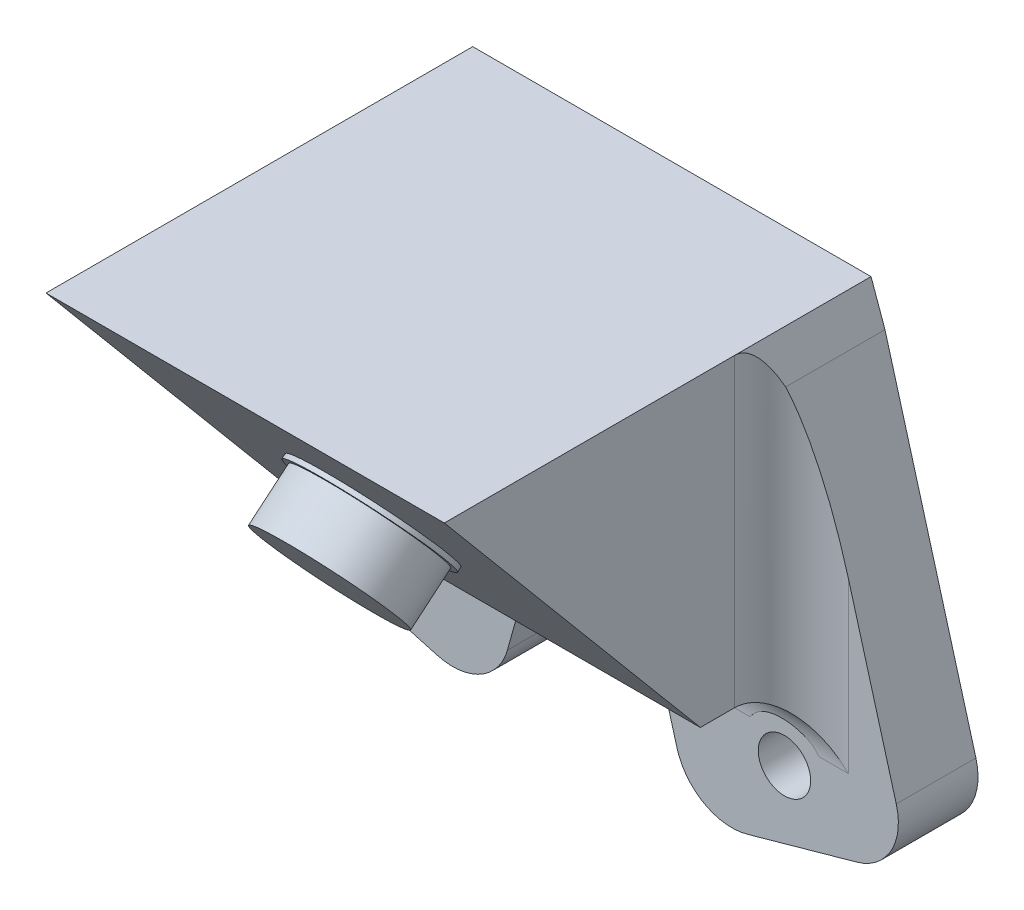
from build123d import *

# Parameters (mm, degrees)
AUFSATZ_LINEAR_AUSTRAGEN1_DEPTH    = 35
SKIZZE3_R                          = 6
AUFSATZ_LINEAR_AUSTRAGEN2_DEPTH    = 5
SKIZZE4_R                          = 6.5
AUFSATZ_LINEAR_AUSTRAGEN3_DEPTH    = 0.4
K_RPER_VERSCHIEBEN_KOPIEREN1_ANGLE = 90
SKIZZE9_R                          = 2.3
AUFSATZ_LINEAR_AUSTRAGEN4_DEPTH    = 7
VERRUNDUNG1_R                      = 5
SKIZZE11_R                         = 3.75
SCHNITT_LINEAR_AUSTRAGEN2_DEPTH    = 10
SKIZZE12_R                         = 1.425000005
SCHNITT_LINEAR_AUSTRAGEN3_DEPTH    = 9


with BuildPart() as part:
    # Skizze1 → Aufsatz-Linear austragen1 (new body)
    with BuildSketch(Plane(origin=(0, 0, 0), x_dir=(0, 0, -1), z_dir=(1, 0, 0))):
        Polygon((0, 0), (26.811555509, 0), (26.811555509, 37.497566339), (0, 15), align=None)
    extrude(amount=AUFSATZ_LINEAR_AUSTRAGEN1_DEPTH)

    # Skizze3 → Aufsatz-Linear austragen2 (add)
    with BuildSketch(Plane(origin=(0, 8.802361333, 7.386058148), x_dir=(1, 0, 0), z_dir=(0, 0.7660444431189768, 0.642787609686541))):
        with Locations(Location((17.5, 27.141814145, 0), (0, 0, 90))):
            Circle(SKIZZE3_R)
    extrude(amount=AUFSATZ_LINEAR_AUSTRAGEN2_DEPTH)

    # Skizze4 → Aufsatz-Linear austragen3 (add)
    with BuildSketch(Plane(origin=(0, 8.802361333, 7.386058148), x_dir=(1, 0, 0), z_dir=(0, 0.7660444431189767, 0.6427876096865409))):
        with Locations(Location((17.5, 27.141814145, 0), (0, 0, 90))):
            Circle(SKIZZE4_R)
    extrude(amount=AUFSATZ_LINEAR_AUSTRAGEN3_DEPTH)


with BuildPart() as part_1:
    # Körper-Verschieben/Kopieren1: moved
    add(part.part.rotate(Axis((0, 13.64378317, -13.405777755), (1, 0, 0)), K_RPER_VERSCHIEBEN_KOPIEREN1_ANGLE))

    # Skizze9 → Aufsatz-Linear austragen4 (add)
    # profile 1 of 2: a face of its own
    with BuildSketch(Plane(origin=(0, 0, -27.049560924), x_dir=(-1, 0, 0), z_dir=(0, 0, -1))):
        Polygon((-13.006801175, 0.238005415), (-8.700779715, -15.171672686), (10.561317912, -9.789145862), (1.223844944, 23.626259531), (0, 27.049560924), (0, 0.238005415), align=None)
        with Locations(Location((-0.609417277, -6.970434083, 0), (0, 0, 90))):
            Circle(SKIZZE9_R, mode=Mode.SUBTRACT)
    # profile 2 of 2: a face of its own
    with BuildSketch(Plane(origin=(0, 0, -27.049560924), x_dir=(-1, 0, 0), z_dir=(0, 0, -1))):
        Polygon((-45.561317912, -9.789145862), (-36.223844944, 23.626259531), (-35, 27.049560924), (-35, 0.238005415), (-21.993198825, 0.238005415), (-26.299220285, -15.171672686), align=None)
        with Locations(Location((-34.390582723, -6.970434083, 0), (0, 0, 270))):
            Circle(SKIZZE9_R, mode=Mode.SUBTRACT)
    extrude(amount=-AUFSATZ_LINEAR_AUSTRAGEN4_DEPTH)

    # Verrundung1
    # the kernel refuses this fillet: 5 mm, written as the material it adds along each edge
    with BuildSketch(Plane(origin=(35, 27.049560924, -20.049560924), x_dir=(1, 0, 0), z_dir=(0, -1, 0))) as verrundung1_piece_1_section:
        with BuildLine():
            CenterArc((VERRUNDUNG1_R, VERRUNDUNG1_R), VERRUNDUNG1_R, 180, 90)
            Line((0, VERRUNDUNG1_R), (-VERRUNDUNG1_R * 0.02, VERRUNDUNG1_R))
            Line((-VERRUNDUNG1_R * 0.02, VERRUNDUNG1_R), (-VERRUNDUNG1_R * 0.02, -VERRUNDUNG1_R * 0.02))
            Line((-VERRUNDUNG1_R * 0.02, -VERRUNDUNG1_R * 0.02), (VERRUNDUNG1_R, -VERRUNDUNG1_R * 0.02))
            Line((VERRUNDUNG1_R, -VERRUNDUNG1_R * 0.02), (VERRUNDUNG1_R, 0))
        make_face()
    verrundung1_piece_1 = extrude(amount=26.811555509, mode=Mode.PRIVATE)
    verrundung1_piece_1 = split(verrundung1_piece_1, bisect_by=Plane(origin=(39.17481741, 13.065806869, -18.82374956), z_dir=(-0.9631048813334838, -0.2691263412444353, -1.6244750072279728e-13)), keep=Keep.TOP, mode=Mode.PRIVATE)
    verrundung1_piece_1 = split(verrundung1_piece_1, bisect_by=Plane(origin=(39.826476164, 13.549090416, -18.82374956), z_dir=(-0.9416340631335743, -0.3366382199729496, -2.0319838344143382e-13)), keep=Keep.TOP, mode=Mode.PRIVATE)
    add(verrundung1_piece_1)
    with BuildSketch(Plane(origin=(35, 0.238005415, -20.049560924), x_dir=(0, 0, 1), z_dir=(-1, 0, 0))) as verrundung1_piece_2_section:
        with BuildLine():
            CenterArc((VERRUNDUNG1_R, -VERRUNDUNG1_R), VERRUNDUNG1_R, 90, 90)
            Line((0, -VERRUNDUNG1_R), (-VERRUNDUNG1_R * 0.02, -VERRUNDUNG1_R))
            Line((-VERRUNDUNG1_R * 0.02, -VERRUNDUNG1_R), (-VERRUNDUNG1_R * 0.02, VERRUNDUNG1_R * 0.02))
            Line((-VERRUNDUNG1_R * 0.02, VERRUNDUNG1_R * 0.02), (VERRUNDUNG1_R, VERRUNDUNG1_R * 0.02))
            Line((VERRUNDUNG1_R, VERRUNDUNG1_R * 0.02), (VERRUNDUNG1_R, 0))
        make_face()
    verrundung1_piece_2 = extrude(amount=25.506801175, mode=Mode.PRIVATE)
    verrundung1_piece_2 = split(verrundung1_piece_2, bisect_by=Plane(origin=(22.762065147, -2.513486336, -18.902354356), z_dir=(0.9631048813334842, 0.2691263412444339, 1.6244750072279647e-13)), keep=Keep.TOP, mode=Mode.PRIVATE)
    verrundung1_piece_2 = verrundung1_piece_2 - Plane(origin=(34.390582723, -6.970434083, -18.902354356), x_dir=(0, -1, 0), z_dir=(0, 0, -1)) * Cylinder(2.3, 72, mode=Mode.PRIVATE)
    add(verrundung1_piece_2)
    with BuildSketch(Plane(origin=(35, 0.238005415, -20.049560924), x_dir=(0, 0, 1), z_dir=(-1, 0, 0))) as verrundung1_piece_3_section:
        with BuildLine():
            CenterArc((VERRUNDUNG1_R, -VERRUNDUNG1_R), VERRUNDUNG1_R, 90, 90)
            Line((0, -VERRUNDUNG1_R), (-VERRUNDUNG1_R * 0.02, -VERRUNDUNG1_R))
            Line((-VERRUNDUNG1_R * 0.02, -VERRUNDUNG1_R), (-VERRUNDUNG1_R * 0.02, VERRUNDUNG1_R * 0.02))
            Line((-VERRUNDUNG1_R * 0.02, VERRUNDUNG1_R * 0.02), (VERRUNDUNG1_R, VERRUNDUNG1_R * 0.02))
            Line((VERRUNDUNG1_R, VERRUNDUNG1_R * 0.02), (VERRUNDUNG1_R, 0))
        make_face()
    verrundung1_piece_3 = extrude(amount=25.506801175, mode=Mode.PRIVATE)
    verrundung1_piece_3 = split(verrundung1_piece_3, bisect_by=Plane(origin=(12.602046932, -1.210462189, -18.857593889), z_dir=(-0.9631048813334842, 0.26912634124443413, 1.6244750072279654e-13)), keep=Keep.TOP, mode=Mode.PRIVATE)
    add(verrundung1_piece_3)
    with BuildSketch(Plane(origin=(0, 0.238005415, -20.049560924), x_dir=(0, 0, 1), z_dir=(1, 0, 0))) as verrundung1_piece_4_section:
        with BuildLine():
            CenterArc((VERRUNDUNG1_R, VERRUNDUNG1_R), VERRUNDUNG1_R, 180, 90)
            Line((0, VERRUNDUNG1_R), (-VERRUNDUNG1_R * 0.02, VERRUNDUNG1_R))
            Line((-VERRUNDUNG1_R * 0.02, VERRUNDUNG1_R), (-VERRUNDUNG1_R * 0.02, -VERRUNDUNG1_R * 0.02))
            Line((-VERRUNDUNG1_R * 0.02, -VERRUNDUNG1_R * 0.02), (VERRUNDUNG1_R, -VERRUNDUNG1_R * 0.02))
            Line((VERRUNDUNG1_R, -VERRUNDUNG1_R * 0.02), (VERRUNDUNG1_R, 0))
        make_face()
    verrundung1_piece_4 = extrude(amount=25.506801175, mode=Mode.PRIVATE)
    verrundung1_piece_4 = split(verrundung1_piece_4, bisect_by=Plane(origin=(12.237934855, -2.513486327, -18.902354361), z_dir=(-0.9631048813334842, 0.26912634124443413, 1.6244750072279654e-13)), keep=Keep.TOP, mode=Mode.PRIVATE)
    verrundung1_piece_4 = verrundung1_piece_4 - Plane(origin=(0.609417277, -6.970434083, -18.902354361), x_dir=(0, 1, 0), z_dir=(0, 0, -1)) * Cylinder(2.3, 72, mode=Mode.PRIVATE)
    add(verrundung1_piece_4)
    with BuildSketch(Plane(origin=(0, 0.238005415, -20.049560924), x_dir=(0, 0, 1), z_dir=(1, 0, 0))) as verrundung1_piece_5_section:
        with BuildLine():
            CenterArc((VERRUNDUNG1_R, VERRUNDUNG1_R), VERRUNDUNG1_R, 180, 90)
            Line((0, VERRUNDUNG1_R), (-VERRUNDUNG1_R * 0.02, VERRUNDUNG1_R))
            Line((-VERRUNDUNG1_R * 0.02, VERRUNDUNG1_R), (-VERRUNDUNG1_R * 0.02, -VERRUNDUNG1_R * 0.02))
            Line((-VERRUNDUNG1_R * 0.02, -VERRUNDUNG1_R * 0.02), (VERRUNDUNG1_R, -VERRUNDUNG1_R * 0.02))
            Line((VERRUNDUNG1_R, -VERRUNDUNG1_R * 0.02), (VERRUNDUNG1_R, 0))
        make_face()
    verrundung1_piece_5 = extrude(amount=25.506801175, mode=Mode.PRIVATE)
    verrundung1_piece_5 = split(verrundung1_piece_5, bisect_by=Plane(origin=(22.397953068, -1.210462189, -18.857593889), z_dir=(0.9631048813334842, 0.2691263412444339, 1.6244750072279647e-13)), keep=Keep.TOP, mode=Mode.PRIVATE)
    add(verrundung1_piece_5)
    with BuildSketch(Plane(origin=(0, 27.049560924, -20.049560924), x_dir=(0, 0, 1), z_dir=(0, -1, 0))) as verrundung1_piece_6_section:
        with BuildLine():
            CenterArc((VERRUNDUNG1_R, VERRUNDUNG1_R), VERRUNDUNG1_R, 180, 90)
            Line((0, VERRUNDUNG1_R), (-VERRUNDUNG1_R * 0.02, VERRUNDUNG1_R))
            Line((-VERRUNDUNG1_R * 0.02, VERRUNDUNG1_R), (-VERRUNDUNG1_R * 0.02, -VERRUNDUNG1_R * 0.02))
            Line((-VERRUNDUNG1_R * 0.02, -VERRUNDUNG1_R * 0.02), (VERRUNDUNG1_R, -VERRUNDUNG1_R * 0.02))
            Line((VERRUNDUNG1_R, -VERRUNDUNG1_R * 0.02), (VERRUNDUNG1_R, 0))
        make_face()
    verrundung1_piece_6 = extrude(amount=26.811555509, mode=Mode.PRIVATE)
    verrundung1_piece_6 = split(verrundung1_piece_6, bisect_by=Plane(origin=(-4.17481741, 13.06580687, -18.82374956), z_dir=(0.9631048813334837, -0.26912634124443535, -1.6244750072279728e-13)), keep=Keep.TOP, mode=Mode.PRIVATE)
    verrundung1_piece_6 = split(verrundung1_piece_6, bisect_by=Plane(origin=(-4.826476163, 13.549090417, -18.82374956), z_dir=(0.9416340631335748, -0.3366382199729482, -2.0319838344143293e-13)), keep=Keep.TOP, mode=Mode.PRIVATE)
    add(verrundung1_piece_6)
    with BuildSketch(Plane(origin=(21.993198825, 0.238005415, -27.049560924), x_dir=(-1, 0, 0), z_dir=(0, 0, 1))) as verrundung1_piece_7:
        with BuildLine():
            CenterArc((VERRUNDUNG1_R * 0.758872343938, VERRUNDUNG1_R), VERRUNDUNG1_R, 195.612285688, 74.387714312)
            Line((-VERRUNDUNG1_R * 0.204232537396, VERRUNDUNG1_R * 0.730873658756), (-VERRUNDUNG1_R * 0.223494635022, VERRUNDUNG1_R * 0.725491131931))
            Line((-VERRUNDUNG1_R * 0.223494635022, VERRUNDUNG1_R * 0.725491131931), (-VERRUNDUNG1_R * 0.0151774468788, -VERRUNDUNG1_R * 0.02))
            Line((-VERRUNDUNG1_R * 0.0151774468788, -VERRUNDUNG1_R * 0.02), (VERRUNDUNG1_R * 0.758872343938, -VERRUNDUNG1_R * 0.02))
            Line((VERRUNDUNG1_R * 0.758872343938, -VERRUNDUNG1_R * 0.02), (VERRUNDUNG1_R * 0.758872343938, 0))
        make_face()
    extrude(amount=7)
    with BuildSketch(Plane(origin=(13.006801175, 0.238005415, -27.049560924), x_dir=(1, 0, 0), z_dir=(0, 0, 1))) as verrundung1_piece_8:
        with BuildLine():
            CenterArc((VERRUNDUNG1_R * 0.758872343938, -VERRUNDUNG1_R), VERRUNDUNG1_R, 90, 74.387714312)
            Line((-VERRUNDUNG1_R * 0.204232537396, -VERRUNDUNG1_R * 0.730873658756), (-VERRUNDUNG1_R * 0.223494635022, -VERRUNDUNG1_R * 0.725491131931))
            Line((-VERRUNDUNG1_R * 0.223494635022, -VERRUNDUNG1_R * 0.725491131931), (-VERRUNDUNG1_R * 0.0151774468788, VERRUNDUNG1_R * 0.02))
            Line((-VERRUNDUNG1_R * 0.0151774468788, VERRUNDUNG1_R * 0.02), (VERRUNDUNG1_R * 0.758872343938, VERRUNDUNG1_R * 0.02))
            Line((VERRUNDUNG1_R * 0.758872343938, VERRUNDUNG1_R * 0.02), (VERRUNDUNG1_R * 0.758872343938, 0))
        make_face()
    extrude(amount=7)
    with BuildSketch(Plane(origin=(47.5, 0.238005415, -20.049560924), x_dir=(0, 0, 1), z_dir=(-1, 0, 0))) as verrundung1_piece_9a_section:
        with BuildLine():
            CenterArc((VERRUNDUNG1_R, -VERRUNDUNG1_R), VERRUNDUNG1_R, 90, 90)
            Line((0, -VERRUNDUNG1_R), (-VERRUNDUNG1_R * 0.02, -VERRUNDUNG1_R))
            Line((-VERRUNDUNG1_R * 0.02, -VERRUNDUNG1_R), (-VERRUNDUNG1_R * 0.02, VERRUNDUNG1_R * 0.02))
            Line((-VERRUNDUNG1_R * 0.02, VERRUNDUNG1_R * 0.02), (VERRUNDUNG1_R, VERRUNDUNG1_R * 0.02))
            Line((VERRUNDUNG1_R, VERRUNDUNG1_R * 0.02), (VERRUNDUNG1_R, 0))
        make_face()
    verrundung1_piece_9a = extrude(amount=38.006801175, mode=Mode.PRIVATE)
    verrundung1_piece_9a = split(verrundung1_piece_9a, bisect_by=Plane(origin=(35, -0.934173805, -18.941336544), z_dir=(1, 0, 0)), keep=Keep.TOP, mode=Mode.PRIVATE)
    verrundung1_piece_9a = split(verrundung1_piece_9a, bisect_by=Plane(origin=(42.794054861, 0.1138779, -18.941336544), z_dir=(-0.9631048813334838, -0.2691263412444353, -1.6244750072279728e-13)), keep=Keep.TOP, mode=Mode.PRIVATE)
    with BuildSketch(Plane(origin=(35, 27.049560924, -20.049560924), x_dir=(1, 0, 0), z_dir=(0, -1, 0))) as verrundung1_piece_9b_section:
        with BuildLine():
            CenterArc((VERRUNDUNG1_R, VERRUNDUNG1_R), VERRUNDUNG1_R, 180, 90)
            Line((0, VERRUNDUNG1_R), (-VERRUNDUNG1_R * 0.02, VERRUNDUNG1_R))
            Line((-VERRUNDUNG1_R * 0.02, VERRUNDUNG1_R), (-VERRUNDUNG1_R * 0.02, -VERRUNDUNG1_R * 0.02))
            Line((-VERRUNDUNG1_R * 0.02, -VERRUNDUNG1_R * 0.02), (VERRUNDUNG1_R, -VERRUNDUNG1_R * 0.02))
            Line((VERRUNDUNG1_R, -VERRUNDUNG1_R * 0.02), (VERRUNDUNG1_R, 0))
        make_face()
    verrundung1_piece_9b = extrude(amount=39.311555509, mode=Mode.PRIVATE)
    verrundung1_piece_9b = split(verrundung1_piece_9b, bisect_by=Plane(origin=(38.695669586, 0.238005415, -19.917388299), z_dir=(0, -1, 0)), keep=Keep.TOP, mode=Mode.PRIVATE)
    verrundung1_piece_9b = split(verrundung1_piece_9b, bisect_by=Plane(origin=(39.091980364, -11.596912781, -19.917388299), z_dir=(-0.2691263412444344, 0.963104881333484, 5.813402738026697e-13)), keep=Keep.TOP, mode=Mode.PRIVATE)
    verrundung1_piece_9b = verrundung1_piece_9b - Plane(origin=(34.390582723, -6.970434083, -19.917388299), x_dir=(0, -1, 0), z_dir=(0, 0, -1)) * Cylinder(2.3, 99, mode=Mode.PRIVATE)
    verrundung1_piece_9 = verrundung1_piece_9a & verrundung1_piece_9b
    add(verrundung1_piece_9)
    with BuildSketch(Plane(origin=(21.993198825, 0.238005415, -27.049560924), x_dir=(-1, 0, 0), z_dir=(0, 0, 1))) as verrundung1_piece_10a_section:
        with BuildLine():
            CenterArc((VERRUNDUNG1_R * 0.758872343938, VERRUNDUNG1_R), VERRUNDUNG1_R, 195.612285688, 74.387714312)
            Line((-VERRUNDUNG1_R * 0.204232537396, VERRUNDUNG1_R * 0.730873658756), (-VERRUNDUNG1_R * 0.223494635022, VERRUNDUNG1_R * 0.725491131931))
            Line((-VERRUNDUNG1_R * 0.223494635022, VERRUNDUNG1_R * 0.725491131931), (-VERRUNDUNG1_R * 0.0151774468788, -VERRUNDUNG1_R * 0.02))
            Line((-VERRUNDUNG1_R * 0.0151774468788, -VERRUNDUNG1_R * 0.02), (VERRUNDUNG1_R * 0.758872343938, -VERRUNDUNG1_R * 0.02))
            Line((VERRUNDUNG1_R * 0.758872343938, -VERRUNDUNG1_R * 0.02), (VERRUNDUNG1_R * 0.758872343938, 0))
        make_face()
    verrundung1_piece_10a = extrude(amount=16.485904299, mode=Mode.PRIVATE)
    verrundung1_piece_10a = split(verrundung1_piece_10a, bisect_by=Plane(origin=(21.313503925, -2.310633004, -14.188122481), z_dir=(0, 0.6427876096870035, -0.7660444431185887)), keep=Keep.TOP, mode=Mode.PRIVATE)
    verrundung1_piece_10a = split(verrundung1_piece_10a, bisect_by=Plane(origin=(21.313503925, -0.491782993, -20.049560924), z_dir=(0, 0, 1)), keep=Keep.TOP, mode=Mode.PRIVATE)
    with BuildSketch(Plane(origin=(35, 0.238005415, -20.049560924), x_dir=(0, 0, 1), z_dir=(-1, 0, 0))) as verrundung1_piece_10b_section:
        with BuildLine():
            CenterArc((VERRUNDUNG1_R, -VERRUNDUNG1_R), VERRUNDUNG1_R, 90, 90)
            Line((0, -VERRUNDUNG1_R), (-VERRUNDUNG1_R * 0.02, -VERRUNDUNG1_R))
            Line((-VERRUNDUNG1_R * 0.02, -VERRUNDUNG1_R), (-VERRUNDUNG1_R * 0.02, VERRUNDUNG1_R * 0.02))
            Line((-VERRUNDUNG1_R * 0.02, VERRUNDUNG1_R * 0.02), (VERRUNDUNG1_R, VERRUNDUNG1_R * 0.02))
            Line((VERRUNDUNG1_R, VERRUNDUNG1_R * 0.02), (VERRUNDUNG1_R, 0))
        make_face()
    verrundung1_piece_10b = extrude(amount=25.506801175, mode=Mode.PRIVATE)
    verrundung1_piece_10b = split(verrundung1_piece_10b, bisect_by=Plane(origin=(13.021336565, 0.290022269, -18.957466714), z_dir=(0.9631048813334842, -0.26912634124443413, -1.6244750072279654e-13)), keep=Keep.TOP, mode=Mode.PRIVATE)
    verrundung1_piece_10b = split(verrundung1_piece_10b, bisect_by=Plane(origin=(21.978663435, 0.290022269, -18.957466714), z_dir=(-0.9631048813334842, -0.2691263412444339, -1.6244750072279647e-13)), keep=Keep.TOP, mode=Mode.PRIVATE)
    verrundung1_piece_10 = verrundung1_piece_10a & verrundung1_piece_10b
    add(verrundung1_piece_10)
    with BuildSketch(Plane(origin=(-12.5, 0.238005415, -20.049560924), x_dir=(0, 0, 1), z_dir=(1, 0, 0))) as verrundung1_piece_11a_section:
        with BuildLine():
            CenterArc((VERRUNDUNG1_R, VERRUNDUNG1_R), VERRUNDUNG1_R, 180, 90)
            Line((0, VERRUNDUNG1_R), (-VERRUNDUNG1_R * 0.02, VERRUNDUNG1_R))
            Line((-VERRUNDUNG1_R * 0.02, VERRUNDUNG1_R), (-VERRUNDUNG1_R * 0.02, -VERRUNDUNG1_R * 0.02))
            Line((-VERRUNDUNG1_R * 0.02, -VERRUNDUNG1_R * 0.02), (VERRUNDUNG1_R, -VERRUNDUNG1_R * 0.02))
            Line((VERRUNDUNG1_R, -VERRUNDUNG1_R * 0.02), (VERRUNDUNG1_R, 0))
        make_face()
    verrundung1_piece_11a = extrude(amount=38.006801175, mode=Mode.PRIVATE)
    verrundung1_piece_11a = split(verrundung1_piece_11a, bisect_by=Plane(origin=(0, -0.934173805, -18.941336544), z_dir=(-1, 0, 0)), keep=Keep.TOP, mode=Mode.PRIVATE)
    verrundung1_piece_11a = split(verrundung1_piece_11a, bisect_by=Plane(origin=(-7.794054861, 0.1138779, -18.941336544), z_dir=(0.9631048813334837, -0.26912634124443535, -1.6244750072279728e-13)), keep=Keep.TOP, mode=Mode.PRIVATE)
    with BuildSketch(Plane(origin=(0, 27.049560924, -20.049560924), x_dir=(0, 0, 1), z_dir=(0, -1, 0))) as verrundung1_piece_11b_section:
        with BuildLine():
            CenterArc((VERRUNDUNG1_R, VERRUNDUNG1_R), VERRUNDUNG1_R, 180, 90)
            Line((0, VERRUNDUNG1_R), (-VERRUNDUNG1_R * 0.02, VERRUNDUNG1_R))
            Line((-VERRUNDUNG1_R * 0.02, VERRUNDUNG1_R), (-VERRUNDUNG1_R * 0.02, -VERRUNDUNG1_R * 0.02))
            Line((-VERRUNDUNG1_R * 0.02, -VERRUNDUNG1_R * 0.02), (VERRUNDUNG1_R, -VERRUNDUNG1_R * 0.02))
            Line((VERRUNDUNG1_R, -VERRUNDUNG1_R * 0.02), (VERRUNDUNG1_R, 0))
        make_face()
    verrundung1_piece_11b = extrude(amount=39.311555509, mode=Mode.PRIVATE)
    verrundung1_piece_11b = split(verrundung1_piece_11b, bisect_by=Plane(origin=(-0.132172609, 0.238005415, -16.353891343), z_dir=(0, -1, 0)), keep=Keep.TOP, mode=Mode.PRIVATE)
    verrundung1_piece_11b = split(verrundung1_piece_11b, bisect_by=Plane(origin=(-0.786583865, -12.520560126, -16.353891343), z_dir=(0.2691263412444344, 0.963104881333484, 5.813402738026697e-13)), keep=Keep.TOP, mode=Mode.PRIVATE)
    verrundung1_piece_11b = verrundung1_piece_11b - Plane(origin=(0.609417277, -6.970434083, -16.353891343), x_dir=(0, 1, 0), z_dir=(0, 0, -1)) * Cylinder(2.3, 99, mode=Mode.PRIVATE)
    verrundung1_piece_11 = verrundung1_piece_11a & verrundung1_piece_11b
    add(verrundung1_piece_11)
    with BuildSketch(Plane(origin=(0, 0.238005415, -20.049560924), x_dir=(0, 0, 1), z_dir=(1, 0, 0))) as verrundung1_piece_12a_section:
        with BuildLine():
            CenterArc((VERRUNDUNG1_R, VERRUNDUNG1_R), VERRUNDUNG1_R, 180, 90)
            Line((0, VERRUNDUNG1_R), (-VERRUNDUNG1_R * 0.02, VERRUNDUNG1_R))
            Line((-VERRUNDUNG1_R * 0.02, VERRUNDUNG1_R), (-VERRUNDUNG1_R * 0.02, -VERRUNDUNG1_R * 0.02))
            Line((-VERRUNDUNG1_R * 0.02, -VERRUNDUNG1_R * 0.02), (VERRUNDUNG1_R, -VERRUNDUNG1_R * 0.02))
            Line((VERRUNDUNG1_R, -VERRUNDUNG1_R * 0.02), (VERRUNDUNG1_R, 0))
        make_face()
    verrundung1_piece_12a = extrude(amount=25.506801175, mode=Mode.PRIVATE)
    verrundung1_piece_12a = split(verrundung1_piece_12a, bisect_by=Plane(origin=(13.021336565, 0.290022269, -18.957466714), z_dir=(0.9631048813334842, -0.26912634124443413, -1.6244750072279654e-13)), keep=Keep.TOP, mode=Mode.PRIVATE)
    verrundung1_piece_12a = split(verrundung1_piece_12a, bisect_by=Plane(origin=(21.978663435, 0.290022269, -18.957466714), z_dir=(-0.9631048813334842, -0.2691263412444339, -1.6244750072279647e-13)), keep=Keep.TOP, mode=Mode.PRIVATE)
    with BuildSketch(Plane(origin=(13.006801175, 0.238005415, -27.049560924), x_dir=(1, 0, 0), z_dir=(0, 0, 1))) as verrundung1_piece_12b_section:
        with BuildLine():
            CenterArc((VERRUNDUNG1_R * 0.758872343938, -VERRUNDUNG1_R), VERRUNDUNG1_R, 90, 74.387714312)
            Line((-VERRUNDUNG1_R * 0.204232537396, -VERRUNDUNG1_R * 0.730873658756), (-VERRUNDUNG1_R * 0.223494635022, -VERRUNDUNG1_R * 0.725491131931))
            Line((-VERRUNDUNG1_R * 0.223494635022, -VERRUNDUNG1_R * 0.725491131931), (-VERRUNDUNG1_R * 0.0151774468788, VERRUNDUNG1_R * 0.02))
            Line((-VERRUNDUNG1_R * 0.0151774468788, VERRUNDUNG1_R * 0.02), (VERRUNDUNG1_R * 0.758872343938, VERRUNDUNG1_R * 0.02))
            Line((VERRUNDUNG1_R * 0.758872343938, VERRUNDUNG1_R * 0.02), (VERRUNDUNG1_R * 0.758872343938, 0))
        make_face()
    verrundung1_piece_12b = extrude(amount=16.485904299, mode=Mode.PRIVATE)
    verrundung1_piece_12b = split(verrundung1_piece_12b, bisect_by=Plane(origin=(13.686496075, -2.310633004, -14.188122481), z_dir=(0, 0.6427876096870035, -0.7660444431185887)), keep=Keep.TOP, mode=Mode.PRIVATE)
    verrundung1_piece_12b = split(verrundung1_piece_12b, bisect_by=Plane(origin=(13.686496075, -0.491782993, -20.049560924), z_dir=(0, 0, 1)), keep=Keep.TOP, mode=Mode.PRIVATE)
    verrundung1_piece_12 = verrundung1_piece_12a & verrundung1_piece_12b
    add(verrundung1_piece_12)
    # the kernel refuses this fillet: 5 mm, written as the material it takes off along each edge
    with BuildSketch(Plane(origin=(45.561317912, -9.789145861, -39.549560924), x_dir=(-0.2691263412444356, 0.9631048813334836, 5.813402738026695e-13), z_dir=(0, 0, 1)), Plane(origin=(26.299220285, -15.171672686, -39.549560924), x_dir=(0.9631048813334839, 0.2691263412444345, 1.6244750072279685e-13), z_dir=(0, 0, 1)), Plane(origin=(8.700779715, -15.171672686, -39.549560924), x_dir=(0.2691263412444342, 0.9631048813334839, 5.813402738026696e-13), z_dir=(0, 0, 1)), Plane(origin=(-10.561317912, -9.789145861, -39.549560924), x_dir=(0.9631048813334839, -0.2691263412444345, -1.6244750072279685e-13), z_dir=(0, 0, 1))) as verrundung1_2_piece_1:
        with BuildLine():
            CenterArc((VERRUNDUNG1_R, VERRUNDUNG1_R), VERRUNDUNG1_R, 180, 90)
            Line((0, VERRUNDUNG1_R), (-VERRUNDUNG1_R * 0.02, VERRUNDUNG1_R))
            Line((-VERRUNDUNG1_R * 0.02, VERRUNDUNG1_R), (-VERRUNDUNG1_R * 0.02, -VERRUNDUNG1_R * 0.02))
            Line((-VERRUNDUNG1_R * 0.02, -VERRUNDUNG1_R * 0.02), (VERRUNDUNG1_R, -VERRUNDUNG1_R * 0.02))
            Line((VERRUNDUNG1_R, -VERRUNDUNG1_R * 0.02), (VERRUNDUNG1_R, 0))
        make_face()
    extrude(amount=32, mode=Mode.SUBTRACT)

    # Skizze11 → Schnitt-Linear austragen2 (cut)
    with BuildSketch(Plane.XY.offset(-20.049560924)):
        with Locations((0.609417277, -6.970434083)):
            Circle(SKIZZE11_R)
        with Locations((34.390582723, -6.970434083)):
            Circle(SKIZZE11_R)
    extrude(amount=SCHNITT_LINEAR_AUSTRAGEN2_DEPTH, mode=Mode.SUBTRACT)

    # Skizze12 → Schnitt-Linear austragen3 (cut)
    with BuildSketch(Plane(origin=(0, 0, -27.049560924), x_dir=(-1, 0, 0), z_dir=(0, 0, -1))):
        with Locations(Location((-17.500000004, 21.873797796, 0), (0, 0, 90))):
            Circle(SKIZZE12_R)
    extrude(amount=-SCHNITT_LINEAR_AUSTRAGEN3_DEPTH, mode=Mode.SUBTRACT)


solid = part_1.part
